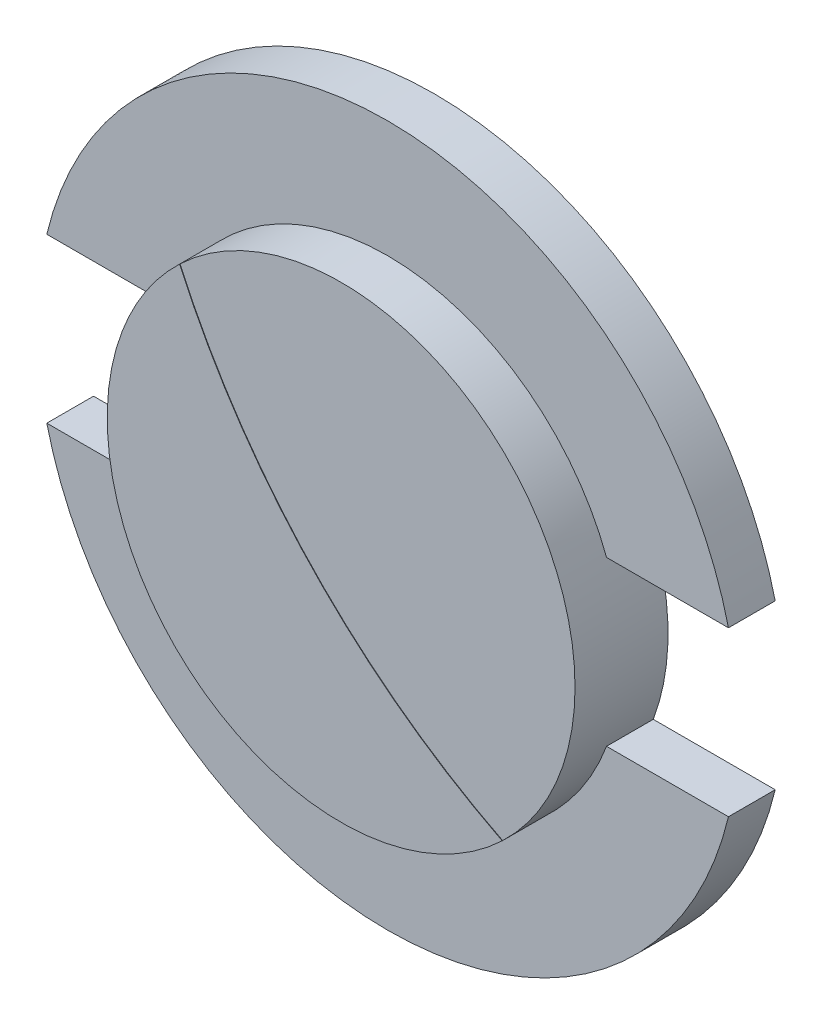
from build123d import *

# Parameters (mm, degrees)
SKETCH1_R           = 7.5
BOSS_EXTRUDE1_DEPTH = 1
SKETCH2_R           = 5
BOSS_EXTRUDE2_DEPTH = 1
CUT_EXTRUDE2_REACH  = 12.654
SKETCH4_R           = 15
CUT_EXTRUDE3_DEPTH  = 0.01


with BuildPart() as part:
    # Sketch1 → Boss-Extrude1 (new body)
    with BuildSketch(Plane(origin=(0, 0, 0), x_dir=(0, 1, 0), z_dir=(0, 0, 1))):
        Circle(SKETCH1_R)
    extrude(amount=BOSS_EXTRUDE1_DEPTH)

    # Sketch2 → Boss-Extrude2 (add)
    with BuildSketch(Plane.XY.offset(1)):
        Circle(SKETCH2_R)
    extrude(amount=BOSS_EXTRUDE2_DEPTH)

    # Sketch3 → Cut-Extrude2 (cut, up to next)
    with BuildSketch(Plane.XY.offset(1), mode=Mode.PRIVATE) as cut_extrude2_sk1:
        with BuildLine():
            Line((-4.683748499, 1.75), (-7.292976073, 1.75))
            ThreePointArc((-7.292976073, 1.75), (-7.5, 0), (-7.292976073, -1.75))
            Line((-7.292976073, -1.75), (-4.683748499, -1.75))
            ThreePointArc((-4.683748499, -1.75), (-5, 0), (-4.683748499, 1.75))
        make_face()
    cut_extrude2_tool1 = extrude(cut_extrude2_sk1.sketch, amount=-CUT_EXTRUDE2_REACH, mode=Mode.PRIVATE) & part.part
    # Sketch3 → Cut-Extrude2 (cut, up to next)
    with BuildSketch(Plane.XY.offset(1), mode=Mode.PRIVATE) as cut_extrude2_sk2:
        with BuildLine():
            ThreePointArc((7.292976073, -1.75), (7.5, 0), (7.292976073, 1.75))
            Line((7.292976073, 1.75), (4.683748499, 1.75))
            ThreePointArc((4.683748499, 1.75), (5, 0), (4.683748499, -1.75))
            Line((4.683748499, -1.75), (7.292976073, -1.75))
        make_face()
    cut_extrude2_tool2 = extrude(cut_extrude2_sk2.sketch, amount=-CUT_EXTRUDE2_REACH, mode=Mode.PRIVATE) & part.part
    add(cut_extrude2_tool1.solids().sort_by_distance((-6.162677, 0, 1))[0], mode=Mode.SUBTRACT)
    add(cut_extrude2_tool2.solids().sort_by_distance((6.162677, 0, 1))[0], mode=Mode.SUBTRACT)

    # Sketch4 → Cut-Extrude3 (cut)
    with BuildSketch(Plane(origin=(0, 0, 2), x_dir=(0, -1, 0), z_dir=(0, 0, 1))):
        with Locations((-9.760681966, 10.233723054)):
            Circle(SKETCH4_R)
    extrude(amount=-CUT_EXTRUDE3_DEPTH, mode=Mode.SUBTRACT)


solid = part.part
